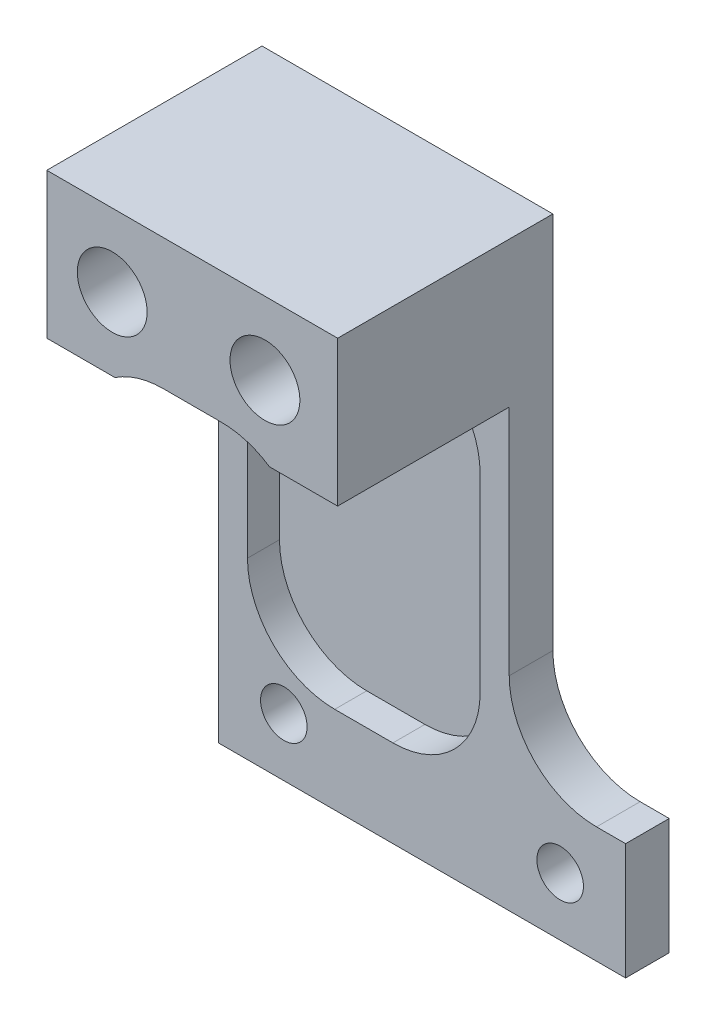
from build123d import *

# Parameters (mm, degrees)
BOSS_EXTRUDE1_DEPTH                                 = 1.5
SKETCH2_W                                           = 14
SKETCH2_H                                           = 5
BOSS_EXTRUDE2_DEPTH                                 = 5.9
M2_TAPPED_HOLE1_D                                   = 1.6
M2_TAPPED_HOLE1_DEPTH                               = 6
M2_TAPPED_HOLE1_TIP                                 = 0.480688495
CUT_EXTRUDE6_DEPTH                                  = 15.274452704
CBORE_FOR_M2_HEX_SOCKET_HEAD_CAP_SCREW1_D           = 2.4
CBORE_FOR_M2_HEX_SOCKET_HEAD_CAP_SCREW1_DEPTH       = 7.5
CBORE_FOR_M2_HEX_SOCKET_HEAD_CAP_SCREW1_CBORE_D     = 4.4
CBORE_FOR_M2_HEX_SOCKET_HEAD_CAP_SCREW1_CBORE_DEPTH = 2.4
CBORE_FOR_M2_HEX_SOCKET_HEAD_CAP_SCREW1_TIP         = 0.721032743
CUT_EXTRUDE7_DEPTH                                  = 7


with BuildPart() as part:
    # Sketch1 → Boss-Extrude1 (new body)
    with BuildSketch(Plane.XY):
        Polygon((-7, -10), (7, -10), (7, 10), (4.75, 10), (-4.75, 10), (-7, 10), align=None)
    extrude(amount=BOSS_EXTRUDE1_DEPTH)

    # Sketch2 → Boss-Extrude2 (add)
    with BuildSketch(Plane.XY.offset(1.5)):
        with Locations((0, 7.5)):
            Rectangle(SKETCH2_W, SKETCH2_H)
    extrude(amount=BOSS_EXTRUDE2_DEPTH)

    # M2 Tapped Hole1
    with Locations(Plane(origin=(-4.75, -8, 0), x_dir=(-1, 0, 0), z_dir=(0, 0, -1))):
        with Locations((0, 0), (-9.5, 0)):
            Hole(M2_TAPPED_HOLE1_D / 2, depth=M2_TAPPED_HOLE1_DEPTH)
            with Locations((0, 0, -(M2_TAPPED_HOLE1_DEPTH + M2_TAPPED_HOLE1_TIP / 2))):  # 118° drill point
                Cone(0, M2_TAPPED_HOLE1_D / 2, M2_TAPPED_HOLE1_TIP, mode=Mode.SUBTRACT)

    # Sketch11 → Cut-Extrude6 (cut, through all)
    with BuildSketch(Plane.XY.offset(7.4)):
        with BuildLine():
            Line((7, -6), (6, -6))
            ThreePointArc((6, -6), (3.878679656, -5.121320344), (3, -3))
            Line((3, -3), (3, 10))
            Line((3, 10), (7, 10))
            Line((7, 10), (7, -6))
        make_face()
    extrude(amount=-CUT_EXTRUDE6_DEPTH, mode=Mode.SUBTRACT)

    # CBORE for M2 Hex Socket Head Cap Screw1
    with Locations(Plane(origin=(-4.75, 7.5, 0), x_dir=(-1, 0, 0), z_dir=(0, 0, -1))):
        with Locations((0, 0), (-5.25, 0)):
            CounterBoreHole(CBORE_FOR_M2_HEX_SOCKET_HEAD_CAP_SCREW1_D / 2, CBORE_FOR_M2_HEX_SOCKET_HEAD_CAP_SCREW1_CBORE_D / 2, CBORE_FOR_M2_HEX_SOCKET_HEAD_CAP_SCREW1_CBORE_DEPTH, depth=CBORE_FOR_M2_HEX_SOCKET_HEAD_CAP_SCREW1_DEPTH)
            with Locations((0, 0, -(CBORE_FOR_M2_HEX_SOCKET_HEAD_CAP_SCREW1_DEPTH + CBORE_FOR_M2_HEX_SOCKET_HEAD_CAP_SCREW1_TIP / 2))):  # 118° drill point
                Cone(0, CBORE_FOR_M2_HEX_SOCKET_HEAD_CAP_SCREW1_D / 2, CBORE_FOR_M2_HEX_SOCKET_HEAD_CAP_SCREW1_TIP, mode=Mode.SUBTRACT)

    # Sketch14 → Cut-Extrude7 (cut)
    with BuildSketch(Plane.XY.offset(7.4)):
        with BuildLine():
            Line((-3, 5.5), (-1, 5.5))
            ThreePointArc((-1, 5.5), (1.121320344, 4.621320344), (2, 2.5))
            Line((2, 2.5), (2, -4))
            ThreePointArc((2, -4), (1.121320344, -6.121320344), (-1, -7))
            Line((-1, -7), (-3, -7))
            ThreePointArc((-3, -7), (-5.121320344, -6.121320344), (-6, -4))
            Line((-6, -4), (-6, 2.5))
            ThreePointArc((-6, 2.5), (-5.121320344, 4.621320344), (-3, 5.5))
        make_face()
    extrude(amount=-CUT_EXTRUDE7_DEPTH, mode=Mode.SUBTRACT)


solid = part.part
